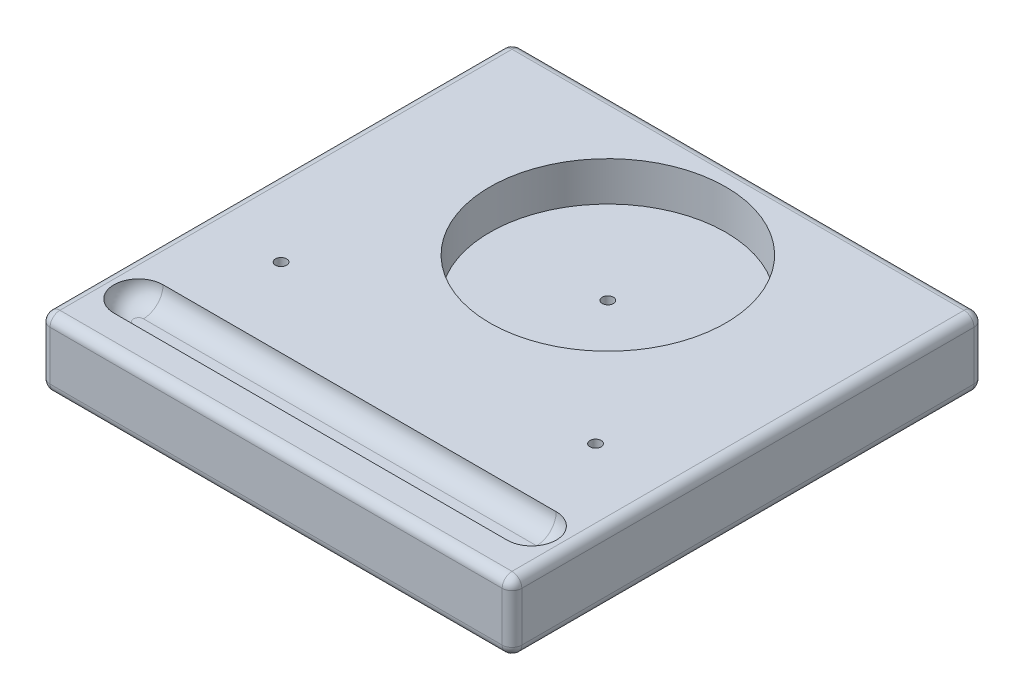
from build123d import *

# Parameters (mm, degrees)
SKETCH3_W                                           = 152.4
SKETCH3_H                                           = 22.225
BOSS_EXTRUDE1_DEPTH                                 = 76.2
FEET_R                                              = 6.35
RUBBER_FEET_DEPTH                                   = 3.175
CUT_EXTRUDE2_DEPTH                                  = 6.35
FILLET2_R                                           = 6.35
FILLET1_R                                           = 3.175
CBORE_FOR_M3_HEX_SOCKET_HEAD_CAP_SCREW1_D           = 3.6
CBORE_FOR_M3_HEX_SOCKET_HEAD_CAP_SCREW1_CBORE_D     = 6.5
CBORE_FOR_M3_HEX_SOCKET_HEAD_CAP_SCREW1_CBORE_DEPTH = 3.4
SKETCH10_R                                          = 38.1
CUT_EXTRUDE3_DEPTH                                  = 12.7


with BuildPart() as part:
    # Sketch3 → Boss-Extrude1 (new, symmetric)
    with BuildSketch(Plane.XY):
        Rectangle(SKETCH3_W, SKETCH3_H)
    extrude(amount=BOSS_EXTRUDE1_DEPTH, both=True)

    # Feet → Rubber Feet (cut)
    with BuildSketch(Plane.XZ.offset(11.1125)):
        with Locations(Location((-63.5, 63.5, 0), (0, 0, 270))):
            Circle(FEET_R)
        with Locations(Location((63.5, 63.5, 0), (0, 0, 90))):
            Circle(FEET_R)
        with Locations(Location((63.5, -63.5, 0), (0, 0, 270))):
            Circle(FEET_R)
        with Locations(Location((-63.5, -63.5, 0), (0, 0, 90))):
            Circle(FEET_R)
    extrude(amount=-RUBBER_FEET_DEPTH, mode=Mode.SUBTRACT)

    # Sketch6 → Cut-Extrude2 (cut)
    with BuildSketch(Plane(origin=(0, 11.1125, 0), x_dir=(1, 0, 0), z_dir=(0, 1, 0))):
        with BuildLine():
            Line((-63.5, -49.2125), (63.5, -49.2125))
            ThreePointArc((63.5, -49.2125), (71.4375, -57.15), (63.5, -65.0875))
            Line((63.5, -65.0875), (-63.5, -65.0875))
            ThreePointArc((-63.5, -65.0875), (-71.4375, -57.15), (-63.5, -49.2125))
        make_face()
    extrude(amount=-CUT_EXTRUDE2_DEPTH, mode=Mode.SUBTRACT)

    # Fillet2
    fillet2_edges = [part.edges().sort_by_distance(p)[0] for p in [
        (0, 4.7625, 49.2125),
        (71.4375, 4.7625, 57.15),
        (0, 4.7625, 65.0875),
        (-71.4375, 4.7625, 57.15),
    ]]
    fillet(fillet2_edges, radius=FILLET2_R - 0.0001)  # a hair under: the kernel refuses the full size

    # Fillet1
    fillet1_edges = [part.edges().sort_by_distance(p)[0] for p in [
        (76.2, 0, 76.2),
        (0, 11.1125, 76.2),
        (-76.2, 0, 76.2),
        (0, 11.1125, -76.2),
        (76.2, 0, -76.2),
        (0, -11.1125, -76.2),
        (-76.2, 0, -76.2),
        (0, -11.1125, 76.2),
        (-76.2, 11.1125, 0),
        (76.2, 11.1125, 0),
        (76.2, -11.1125, 0),
        (-76.2, -11.1125, 0),
    ]]
    fillet(fillet1_edges, radius=FILLET1_R)

    # CBORE for M3 Hex Socket Head Cap Screw1 (through all)
    with Locations(Plane(origin=(0, -11.1125, 0), x_dir=(-1, 0, 0), z_dir=(0, -1, 0))):
        with Locations((-50.8, -23.8125), (50.8, -23.8125)):
            CounterBoreHole(CBORE_FOR_M3_HEX_SOCKET_HEAD_CAP_SCREW1_D / 2, CBORE_FOR_M3_HEX_SOCKET_HEAD_CAP_SCREW1_CBORE_D / 2, CBORE_FOR_M3_HEX_SOCKET_HEAD_CAP_SCREW1_CBORE_DEPTH)

    # Sketch10 → Cut-Extrude3 (cut)
    with BuildSketch(Plane(origin=(0, 11.1125, 0), x_dir=(1, 0, 0), z_dir=(0, 1, 0))):
        with Locations(Location((0, 30.95625, 0), (0, 0, 270))):
            Circle(SKETCH10_R)
    extrude(amount=-CUT_EXTRUDE3_DEPTH, mode=Mode.SUBTRACT)

    # Sketch13 → CBORE for M3 Hex Socket Head Cap Screw2 (revolve, cut)
    with BuildSketch(Plane(origin=(0, -11.1125, -30.95625), x_dir=(0, 0, -1), z_dir=(1, 0, 0))):
        Polygon((0, 0), (0, 22.225), (1.8, 22.225), (1.8, 3.4), (3.25, 3.4), (3.25, 0.025), (3.275, 0), align=None)
    revolve(axis=Axis((0, -17.4625, -30.95625), (0, 1, 0)), mode=Mode.SUBTRACT)


solid = part.part
